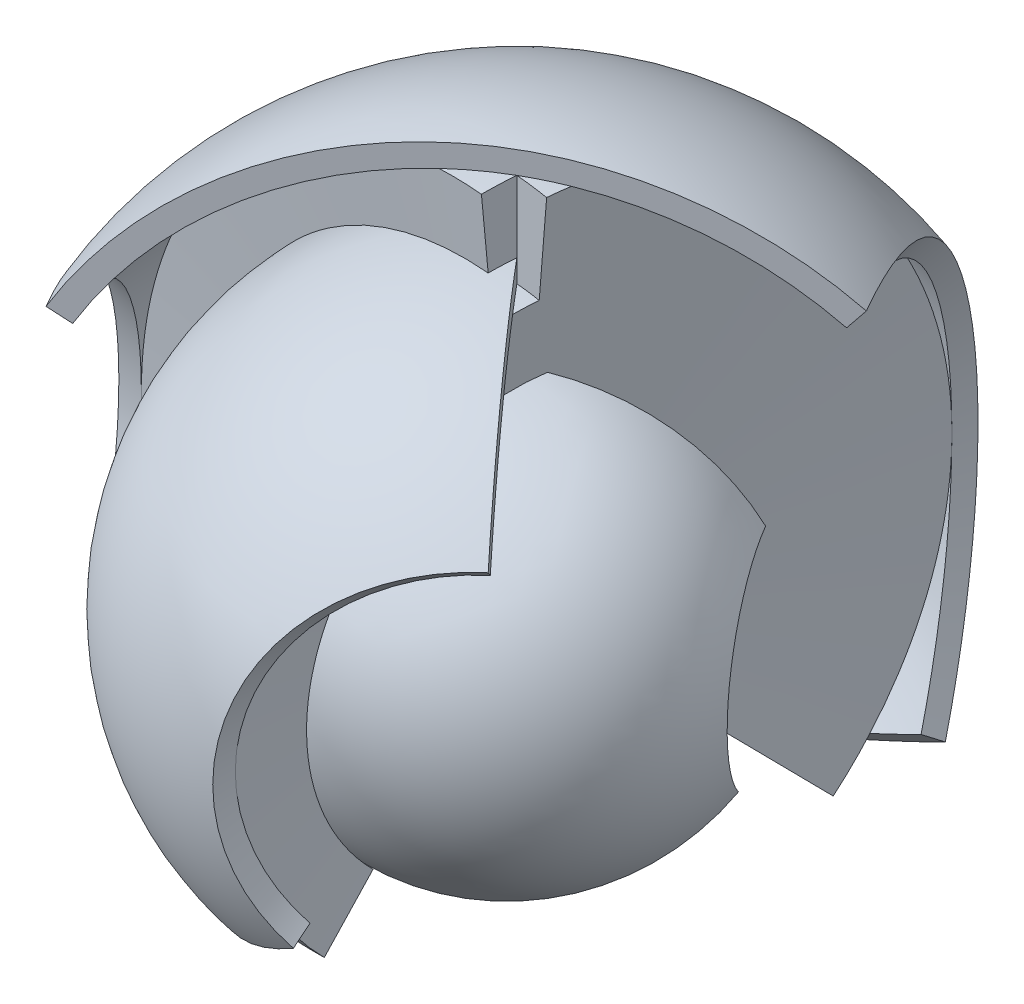
from build123d import *

# Parameters (mm, degrees)
SWEEP2_ANGLE = 135


# Read off the part's stored shape, not the designer's step: Sweep2
with BuildPart() as part:
    # Sweep2 outline → Sweep2 (revolve)
    with BuildSketch(Plane(origin=(0, 0, 0), x_dir=(0.5416752204196997, -0.707106781186551, -0.4545194776720406), z_dir=(-0.5416752204197053, -0.7071067811865439, 0.4545194776720451))):
        with BuildLine():
            Line((32.139380484, -38.302222156), (39.852831801, -47.494755473))
            ThreePointArc((39.852831801, -47.494755473), (62, 0), (39.852831801, 47.494755473))
            Line((39.852831801, 47.494755473), (32.139380484, 38.302222156))
            ThreePointArc((32.139380484, 38.302222156), (50, 0), (32.139380484, -38.302222156))
        make_face()
    revolve(axis=Axis((0, 0, 0), (0.6427876096865381, 0, 0.7660444431189789)), revolution_arc=SWEEP2_ANGLE)



with BuildPart() as body_2:
    # Sweep3: sweep along a path in Sketch15
    with BuildLine(Plane(origin=(0, 0, 0), x_dir=(-0.49999999999999506, 0, -0.8660254037844415), z_dir=(0.8660254037844415, 0, -0.49999999999999506))) as sweep3_path:
        ThreePointArc((0, 106.00000000000001), (-97.93123044619651, 40.56444383069927), (-74.95331880577362, -74.95331880577444))
    # Sketch2 → Sweep3 (sweep)
    with BuildSketch(Plane(origin=(0, 0, 0), x_dir=(1, 0, 0), z_dir=(0, 1, 0))):
        with BuildLine():
            Line((100, -3.4668e-13), (112, -3.9105e-13))
            ThreePointArc((112, -3.9105e-13), (71.99221228489193, -85.79697762932594), (-19.448595898696997, -110.29846833736717))
            Line((-19.448595898696997, -110.29846833736717), (-17.364817766693747, -98.48077530122067))
            ThreePointArc((-17.364817766693747, -98.48077530122067), (64.27876096865351, -76.60444431189816), (100, -3.4668e-13))
        make_face()
    sweep(path=sweep3_path.line)


with BuildPart() as body_3:
    # Sweep4: sweep along a path in Sketch16
    with BuildLine(Plane(origin=(0, 0, 0), x_dir=(0.7660444431189743, 0, -0.6427876096865438), z_dir=(0.6427876096865438, 0, 0.7660444431189745))) as sweep4_path:
        ThreePointArc((0, 156), (-144.12520707176088, 59.69861544895363), (-110.3086578651008, -110.308657865102))
    # Sketch3 → Sweep4 (sweep)
    with BuildSketch(Plane(origin=(0, 0, 0), x_dir=(1, 0, 0), z_dir=(0, 1, 0))):
        with BuildLine():
            Line((-1.04744e-12, -150), (-1.13124e-12, -162))
            ThreePointArc((-1.13124e-12, -162), (-124.09919978527539, -104.13159276921829), (-159.53885598797743, 28.13100478204443))
            Line((-159.53885598797743, 28.13100478204443), (-147.72116295183096, 26.047226650041136))
            ThreePointArc((-147.72116295183096, 26.047226650041136), (-114.90666646784759, -96.4181414529799), (-1.04744e-12, -150))
        make_face()
    sweep(path=sweep4_path.line)


with BuildPart() as body_4:
    # Sweep5: sweep along a path in Sketch17
    with BuildLine(Plane(origin=(0, 0, 0), x_dir=(0.5000000000000013, 0, 0.8660254037844379), z_dir=(-0.8660254037844378, 0, 0.5000000000000012))) as sweep5_path:
        ThreePointArc((0, 206.00000000000003), (-190.3191836973253, 78.83278706720802), (-145.663996924428, -145.66399692442957))
    # Sketch4 → Sweep5 (sweep)
    with BuildSketch(Plane(origin=(0, 0, 0), x_dir=(1, 0, 0), z_dir=(0, 1, 0))):
        with BuildLine():
            Line((-200, -7.4728e-13), (-212, -7.9212e-13))
            ThreePointArc((-212, -7.9212e-13), (-136.27097325354666, 162.40142194122313), (36.81341366538924, 208.77924363858813))
            Line((36.81341366538924, 208.77924363858813), (34.72963553338607, 196.9615506024416))
            ThreePointArc((34.72963553338607, 196.9615506024416), (-128.55752193730814, 153.2088886237954), (-200, -7.4728e-13))
        make_face()
    sweep(path=sweep5_path.line)


with BuildPart() as part_1:
    add(part.part)

    add(body_2.part)  # Sweep6 merges body 2
    # Sweep6: sweep along a path in Sketch22
    with BuildLine(Plane(origin=(0, 0, 0), x_dir=(-0.9961946980917453, 0, -0.08715574274766177), z_dir=(0.08715574274766177, 0, -0.9961946980917453))) as sweep6_path:
        ThreePointArc((0, 77.99999999999999), (-72.06260353588043, 29.849307724476812), (-55.1543289325504, -55.154328932551))
    # Sketch5 → Sweep6 (sweep)
    with BuildSketch(Plane(origin=(0, 0, 0), x_dir=(1, 0, 0), z_dir=(0, 1, 0))):
        with BuildLine():
            Line((62, -2.1647e-13), (100, -3.4915e-13))
            ThreePointArc((100, -3.4915e-13), (99.61946980917453, -8.715574274766185), (98.48077530122076, -17.364817766693417))
            Line((98.48077530122076, -17.364817766693417), (61.058080686756846, -10.766187015349916))
            ThreePointArc((61.058080686756846, -10.766187015349916), (61.76407128168819, -5.403656050355033), (62, -2.1647e-13))
        make_face()
    sweep(path=sweep6_path.line)


with BuildPart() as sweep7_tool:
    # Sweep7: sweep along a path in Sketch23
    with BuildLine(Plane(origin=(0, 0, 0), x_dir=(0.08715574274765134, 0, -0.9961946980917462), z_dir=(0.9961946980917462, 0, 0.08715574274765134))) as sweep7_path:
        ThreePointArc((0, 128), (-118.25658016144483, 48.98347934273119), (-90.50966799187758, -90.50966799187859))
    # Sketch6 → Sweep7 (sweep)
    with BuildSketch(Plane(origin=(0, 0, 0), x_dir=(1, 0, 0), z_dir=(0, 1, 0))):
        with BuildLine():
            Line((-3.86585e-12, -112), (-5.17747e-12, -150))
            ThreePointArc((-5.17747e-12, -150), (-13.073361412153913, -149.4292047137614), (-26.047226650044717, -147.72116295183034))
            Line((-26.047226650044717, -147.72116295183034), (-19.448595898700052, -110.29846833736664))
            ThreePointArc((-19.448595898700052, -110.29846833736664), (-9.761443187741587, -111.57380618627518), (-3.86585e-12, -112))
        make_face()
    sweep(path=sweep7_path.line)


with BuildPart() as part_2:
    add(part_1.part)


with BuildPart() as part_3:
    # Sweep7: joined with sweep7_tool
    add(part_2.part.fuse(sweep7_tool.part, body_3.part, tol=0.00001))


    add(body_4.part)  # Sweep8 merges body 4
    # Sweep8: sweep along a path in Sketch24
    with BuildLine(Plane(origin=(0, 0, 0), x_dir=(0.9961946980917459, 0, 0.08715574274765439), z_dir=(-0.08715574274765439, 0, 0.996194698091746))) as sweep8_path:
        ThreePointArc((0, 178), (-164.45055678700922, 68.11765096098556), (-125.86500705120477, -125.86500705120612))
    # Sketch7 → Sweep8 (sweep)
    with BuildSketch(Plane(origin=(0, 0, 0), x_dir=(1, 0, 0), z_dir=(0, 1, 0))):
        with BuildLine():
            Line((-162, -6.053e-13), (-200, -7.4728e-13))
            ThreePointArc((-200, -7.4728e-13), (-199.23893961834912, 17.431148549531017), (-196.9615506024417, 34.72963553338542))
            Line((-196.9615506024417, 34.72963553338542), (-159.53885598797785, 28.131004782042204))
            ThreePointArc((-159.53885598797785, 28.131004782042204), (-161.38354109086288, 14.119230325120132), (-162, -6.053e-13))
        make_face()
    sweep(path=sweep8_path.line)

    # Sweep9: sweep along a path in Sketch25
    with BuildLine(Plane(origin=(0, 0, 0), x_dir=(-0.08715574274765836, 0, 0.9961946980917455), z_dir=(-0.9961946980917457, 0, -0.08715574274765837))) as sweep9_path:
        ThreePointArc((0, 128), (-118.25658016144483, 48.98347934273119), (-90.50966799187758, -90.50966799187859))
    # Sketch8 → Sweep9 (sweep)
    with BuildSketch(Plane(origin=(0, 0, 0), x_dir=(1, 0, 0), z_dir=(0, 1, 0))):
        with BuildLine():
            Line((10.766187015349702, 61.05808068675688), (34.72963553338614, 196.96155060244158))
            ThreePointArc((34.72963553338614, 196.96155060244158), (17.43114854953167, 199.2389396183491), (0, 200))
            Line((0, 200), (0, 61.99999999999999))
            ThreePointArc((0, 61.99999999999999), (5.403656050354817, 61.76407128168821), (10.766187015349702, 61.05808068675688))
        make_face()
    sweep(path=sweep9_path.line)


solid = part_3.part
